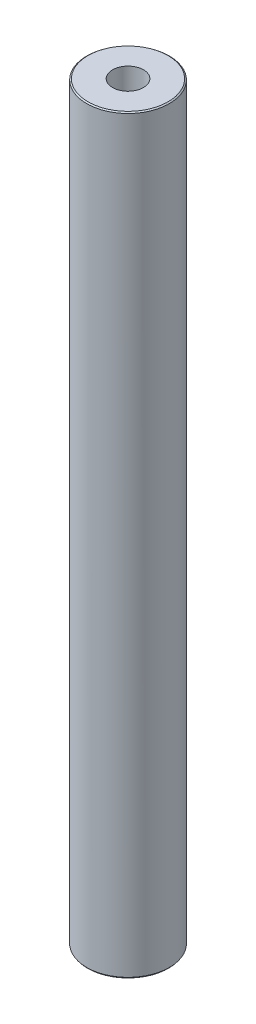
from build123d import *
from OCP.BRepFilletAPI import BRepFilletAPI_MakeChamfer

# Parameters (mm, degrees)
SKETCH1_R           = 30
BOSS_EXTRUDE1_DEPTH = 544.95372163
SKETCH2_R           = 11.220508601
CUT_EXTRUDE1_DEPTH  = 547.602743058
CHAMFER1_SIZE       = 0.714610873
CHAMFER1_SIZE2      = 0.913185378


with BuildPart() as part:
    # Sketch1 → Boss-Extrude1 (new body)
    with BuildSketch(Plane(origin=(0, 0, 0), x_dir=(1, 0, 0), z_dir=(0, 1, 0))):
        Circle(SKETCH1_R)
    extrude(amount=BOSS_EXTRUDE1_DEPTH)

    # Sketch2 → Cut-Extrude1 (cut, through all)
    with BuildSketch(Plane(origin=(0, 0, 0), x_dir=(1, 0, 0), z_dir=(0, 1, 0))):
        Circle(SKETCH2_R)
    extrude(amount=CUT_EXTRUDE1_DEPTH, mode=Mode.SUBTRACT)

    # Chamfer1: one chamfer whose edges measure the first distance from different faces: ONE call of the kernel's chamfer builder (chamfer() names one face for all edges)
    chamfer1_edges_1 = [part.edges().sort_by_distance(p)[0] for p in [
        (-30, 544.95372163, 0),
    ]]
    chamfer1_side_1 = [part.faces().sort_by_distance(p)[0] for p in [
        (-30, 272.476860815, 0),
    ]]
    chamfer1_edges_2 = [part.edges().sort_by_distance(p)[0] for p in [
        (-30, 0, 0),
    ]]
    chamfer1_side_2 = [part.faces().sort_by_distance(p)[0] for p in [
        (-29.151471863, 0, 0),
    ]]
    chamfer1 = BRepFilletAPI_MakeChamfer(part.part.solid().wrapped)
    for e in chamfer1_edges_1:
        chamfer1.Add(CHAMFER1_SIZE, CHAMFER1_SIZE2, e.wrapped, chamfer1_side_1[0].wrapped)  # the first distance lies on this face
    for e in chamfer1_edges_2:
        chamfer1.Add(CHAMFER1_SIZE, CHAMFER1_SIZE2, e.wrapped, chamfer1_side_2[0].wrapped)  # the first distance lies on this face
    add(Compound.cast(chamfer1.Shape()), mode=Mode.REPLACE)


solid = part.part
